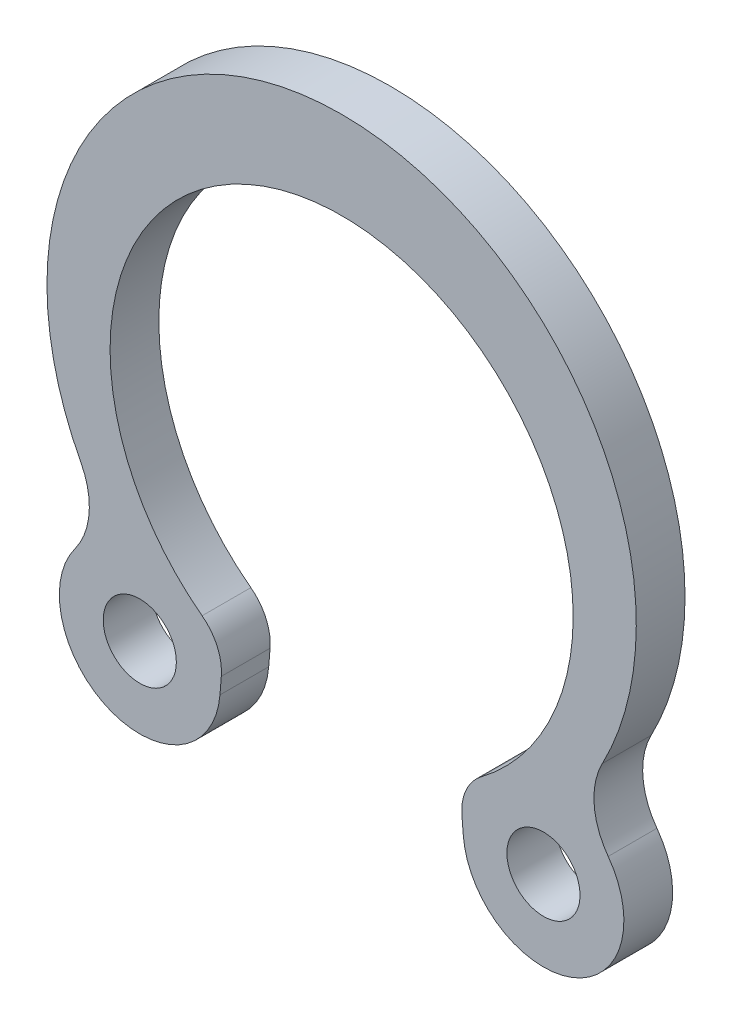
from build123d import *

# Parameters (mm, degrees)
SKETCH_2_R      = 0.75
EXTRUDE_1_DEPTH = 1


with BuildPart() as part:
    # Эскиз2 → Бобышка-Вытянуть1 (new body)
    with BuildSketch(Plane.XY):
        with BuildLine():
            Line((1e-09, 4.75), (0, 6.55))
            ThreePointArc((0, 6.55), (-5.174962188, 3.628926318), (-5.348211601, -2.311013895))
            ThreePointArc((-5.348211601, -2.311013895), (-5.179687707, -3.123034993), (-5.468378103, -3.900490086))
            ThreePointArc((-5.468378103, -3.900490086), (-4.719418002, -6.425234093), (-2.496065251, -5.013860266))
            Line((-2.496065251, -5.013860266), (-2.468043041, -4.670176577))
            ThreePointArc((-2.468043041, -4.670176577), (-2.552204681, -4.179903536), (-2.862172849, -3.790839825))
            ThreePointArc((-2.862172849, -3.790839825), (-4.503831101, 1.50930627), (1e-09, 4.75))
        make_face()
        with Locations((-4.140632757, -4.880077906)):
            Circle(SKETCH_2_R, mode=Mode.SUBTRACT)
    extrude(amount=EXTRUDE_1_DEPTH)

    # Зеркальное отражение1: part across plane


with BuildPart() as part_1:
    add(part.part)
    add(part.part.mirror(Plane(origin=(1e-09, 4.75, 1), x_dir=(0, 0, 1), z_dir=(-1.0, -3.8988208278176163e-10, 0))))


solid = part_1.part
